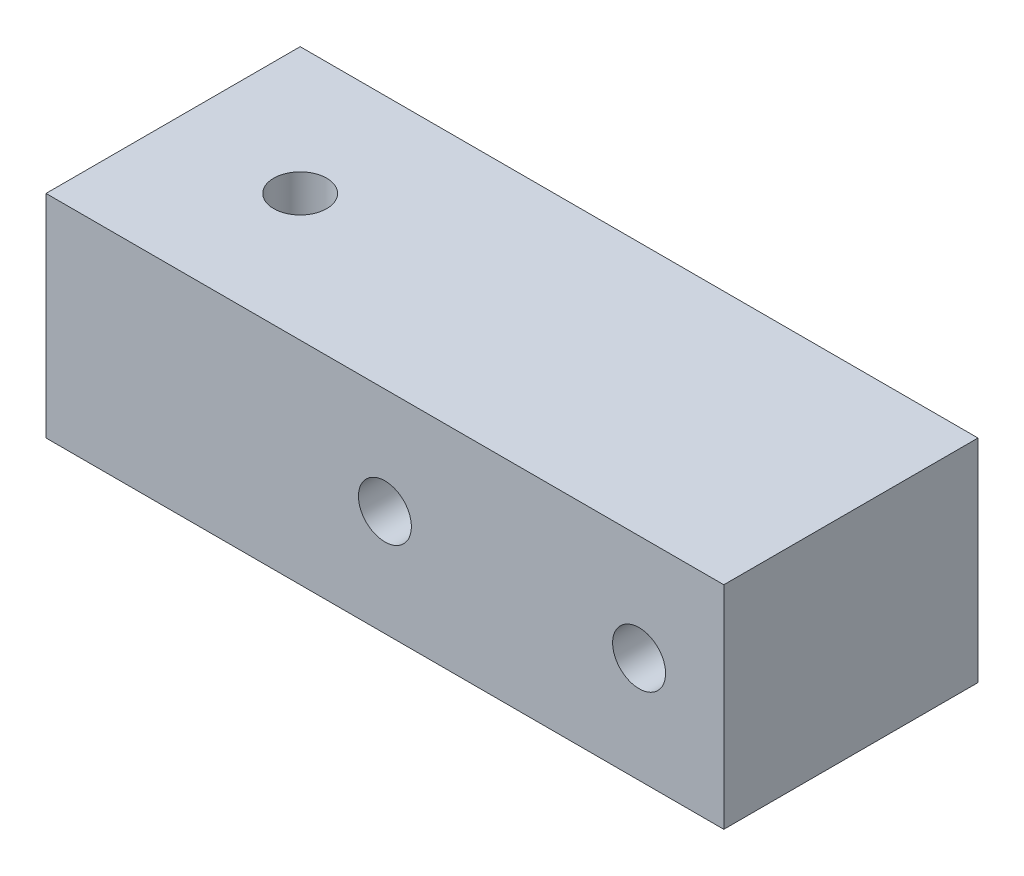
from build123d import *

# Parameters (mm, degrees)
SKETCH1_W                           = 32
SKETCH1_H                           = 12
BOSS_EXTRUDE1_DEPTH                 = 10
TAP_DRILL_FOR_M3X0_5_TAP1_D         = 2.5
TAP_START                           = -12
TAP_DRILL_FOR_M3X0_5_TAP2_OUTLINE_R = 1.25
TAP_DRILL_FOR_M3X0_5_TAP2_DEPTH     = 12


# Read off the part's stored shape, not the designer's step: Tap Drill for M3x0.5 Tap2
with BuildPart() as part:
    # Sketch1 → Boss-Extrude1 (new body)
    with BuildSketch(Plane(origin=(0, 0, 0), x_dir=(1, 0, 0), z_dir=(0, 1, 0))):
        with Locations((16, 6)):
            Rectangle(SKETCH1_W, SKETCH1_H)
    extrude(amount=BOSS_EXTRUDE1_DEPTH)

    # Tap Drill for M3x0.5 Tap1 (through all)
    with Locations(Plane(origin=(0, 10, 0), x_dir=(1, 0, 0), z_dir=(0, 1, 0))):
        with Locations((6, 6)):
            Hole(TAP_DRILL_FOR_M3X0_5_TAP1_D / 2)

    # Tap Drill for M3x0.5 Tap2 outline → Tap Drill for M3x0.5 Tap2 (cut)
    with BuildSketch(Plane.XY.offset(TAP_START)):
        with Locations((16, 5)):
            Circle(TAP_DRILL_FOR_M3X0_5_TAP2_OUTLINE_R)
        with Locations((28, 5)):
            Circle(TAP_DRILL_FOR_M3X0_5_TAP2_OUTLINE_R)
    extrude(amount=TAP_DRILL_FOR_M3X0_5_TAP2_DEPTH, mode=Mode.SUBTRACT)


solid = part.part
